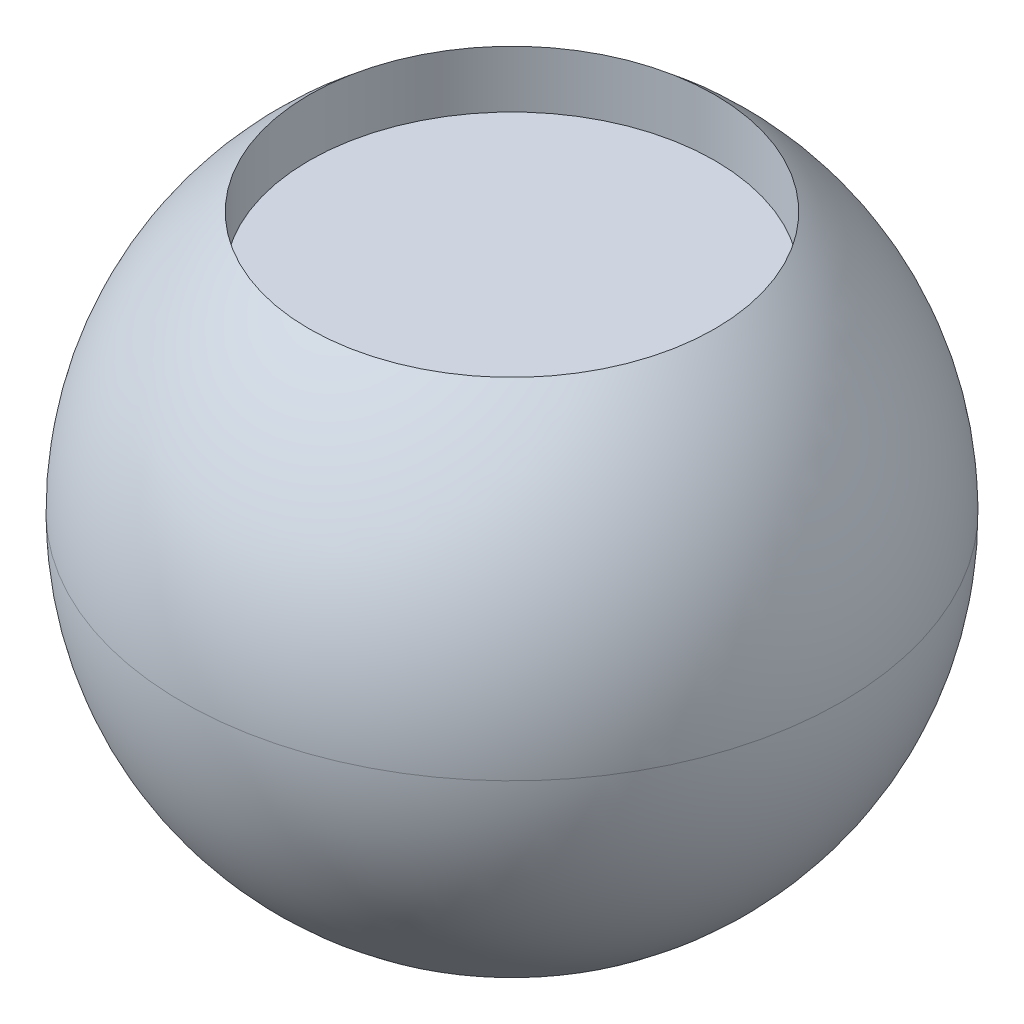
from build123d import *

# Parameters (mm, degrees)
SKETCH5_R              = 20
BUTTON_CUT_DEPTH       = 12.5
SPLIT1_SURFACE_1_BACK  = 109.755
SPLIT1_SURFACE_1_DEPTH = 219.51
SPLIT1_SURFACE_2_BACK  = 109.755
SPLIT1_SURFACE_2_DEPTH = 219.51


# Read off the part's stored shape, not the designer's step: Shell1
with BuildPart() as part:
    # Sketch1 → Sphere (revolve)
    with BuildSketch(Plane.XY):
        with BuildLine():
            Line((0, -32.5), (0, 32.5))
            ThreePointArc((0, 32.5), (-32.5, 0), (0, -32.5))
        make_face()
    revolve(axis=Axis((0, -32.5, 0), (0, 1, 0)))

    # Sketch5 → Button Cut (cut)
    with BuildSketch(Plane(origin=(0, 32.5, 0), x_dir=(1, 0, 0), z_dir=(0, 1, 0))):
        with Locations(Location((0, 0, 0), (0, 0, 270))):
            Circle(SKETCH5_R)
    extrude(amount=-BUTTON_CUT_DEPTH, mode=Mode.SUBTRACT)

    # Shell1 outline → Shell1 (revolve, cut)
    with BuildSketch(Plane.XY):
        with BuildLine():
            Line((0, 17), (0, -29.5))
            ThreePointArc((0, -29.5), (26.600771792, -12.753389358), (22.999999991, 18.472953214))
            Line((22.999999991, 18.472953214), (23, 17))
            Line((23, 17), (0, 17))
        make_face()
    revolve(axis=Axis((0, 0, 0), (0, 1, 0)), mode=Mode.SUBTRACT)


with BuildPart() as body_2:
    # Split1: the piece behind the surface
    add(part.part)
    # Split1 surface: a surface, the sketch's curves swept straight by 219.51 mm
    with BuildLine(Plane.XY.offset(-SPLIT1_SURFACE_1_BACK), mode=Mode.PRIVATE) as split1_surface_1_path:
        Line((-37.5, 0), (37.5, 0))
    split1_surface_1 = Shell.extrude(split1_surface_1_path.wire(), (0 * SPLIT1_SURFACE_1_DEPTH, 0 * SPLIT1_SURFACE_1_DEPTH, 1 * SPLIT1_SURFACE_1_DEPTH))
    split(bisect_by=split1_surface_1, keep=Keep.BOTTOM)


with BuildPart() as part_1:
    add(part.part)

    # Split1: split by a surface, the side it looks to stays
    # Split1 surface: a surface, the sketch's curves swept straight by 219.51 mm
    with BuildLine(Plane.XY.offset(-SPLIT1_SURFACE_2_BACK), mode=Mode.PRIVATE) as split1_surface_2_path:
        Line((-37.5, 0), (37.5, 0))
    split1_surface_2 = Shell.extrude(split1_surface_2_path.wire(), (0 * SPLIT1_SURFACE_2_DEPTH, 0 * SPLIT1_SURFACE_2_DEPTH, 1 * SPLIT1_SURFACE_2_DEPTH))
    split(bisect_by=split1_surface_2, keep=Keep.TOP)


solid = Compound([body_2.part, part_1.part])
